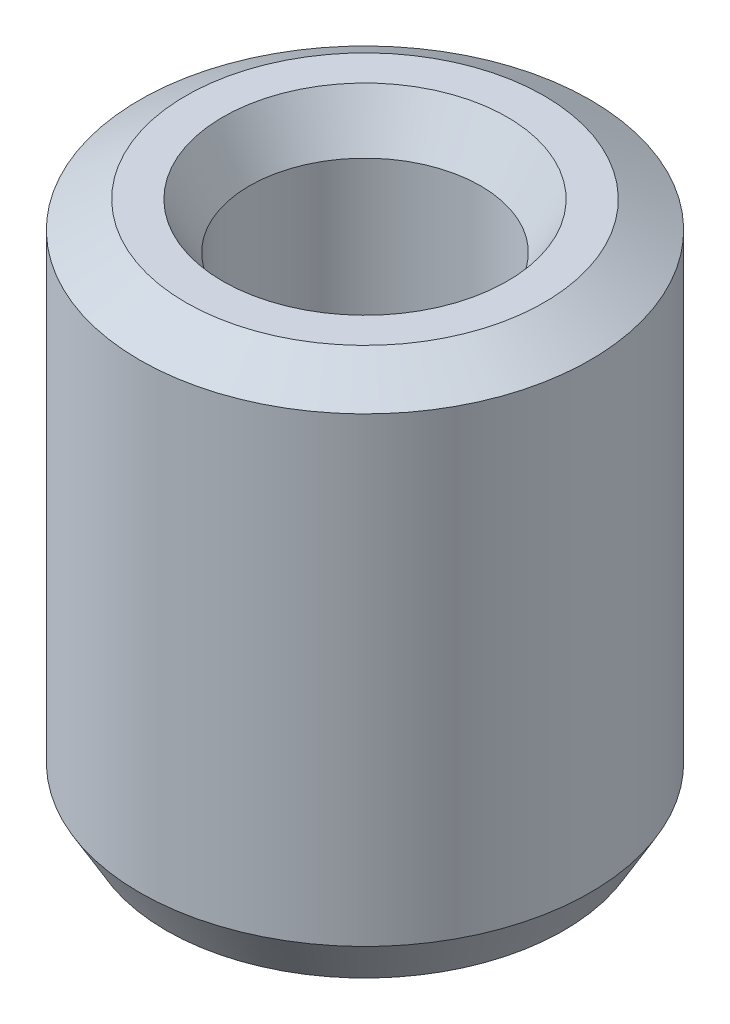
from build123d import *
from OCP.BRepFilletAPI import BRepFilletAPI_MakeChamfer

# Parameters (mm, degrees)
SKETCH1_R           = 10
BOSS_EXTRUDE1_DEPTH = 23.703474111
SKETCH2_R           = 5.128349271
CUT_EXTRUDE1_DEPTH  = 28.601715254
CHAMFER1_SIZE       = 1.183853267
CHAMFER1_SIZE2      = 2.050494007


with BuildPart() as part:
    # Sketch1 → Boss-Extrude1 (new body)
    with BuildSketch(Plane(origin=(0, 0, 0), x_dir=(1, 0, 0), z_dir=(0, 1, 0))):
        Circle(SKETCH1_R)
    extrude(amount=BOSS_EXTRUDE1_DEPTH)

    # Sketch2 → Cut-Extrude1 (cut, through all)
    with BuildSketch(Plane(origin=(0, 0, 0), x_dir=(1, 0, 0), z_dir=(0, 1, 0))):
        Circle(SKETCH2_R)
    extrude(amount=CUT_EXTRUDE1_DEPTH, mode=Mode.SUBTRACT)

    # Chamfer1: one chamfer whose edges measure the first distance from different faces: ONE call of the kernel's chamfer builder (chamfer() names one face for all edges)
    chamfer1_edges_1 = [part.edges().sort_by_distance(p)[0] for p in [
        (-5.128349271, 23.703474111, 0),
    ]]
    chamfer1_side_1 = [part.faces().sort_by_distance(p)[0] for p in [
        (-9.717157288, 23.703474111, 0),
    ]]
    chamfer1_edges_2 = [part.edges().sort_by_distance(p)[0] for p in [
        (-5.128349271, 0, 0),
    ]]
    chamfer1_side_2 = [part.faces().sort_by_distance(p)[0] for p in [
        (-5.128349271, 11.851737056, 0),
    ]]
    chamfer1_edges_3 = [part.edges().sort_by_distance(p)[0] for p in [
        (-10, 0, 0),
    ]]
    chamfer1_side_3 = [part.faces().sort_by_distance(p)[0] for p in [
        (-9.717157288, 0, 0),
    ]]
    chamfer1_edges_4 = [part.edges().sort_by_distance(p)[0] for p in [
        (-10, 23.703474111, 0),
    ]]
    chamfer1_side_4 = [part.faces().sort_by_distance(p)[0] for p in [
        (-10, 11.851737056, 0),
    ]]
    chamfer1 = BRepFilletAPI_MakeChamfer(part.part.solid().wrapped)
    for e in chamfer1_edges_1:
        chamfer1.Add(CHAMFER1_SIZE, CHAMFER1_SIZE2, e.wrapped, chamfer1_side_1[0].wrapped)  # the first distance lies on this face
    for e in chamfer1_edges_2:
        chamfer1.Add(CHAMFER1_SIZE, CHAMFER1_SIZE2, e.wrapped, chamfer1_side_2[0].wrapped)  # the first distance lies on this face
    for e in chamfer1_edges_3:
        chamfer1.Add(CHAMFER1_SIZE, CHAMFER1_SIZE2, e.wrapped, chamfer1_side_3[0].wrapped)  # the first distance lies on this face
    for e in chamfer1_edges_4:
        chamfer1.Add(CHAMFER1_SIZE, CHAMFER1_SIZE2, e.wrapped, chamfer1_side_4[0].wrapped)  # the first distance lies on this face
    add(Compound.cast(chamfer1.Shape()), mode=Mode.REPLACE)


solid = part.part
